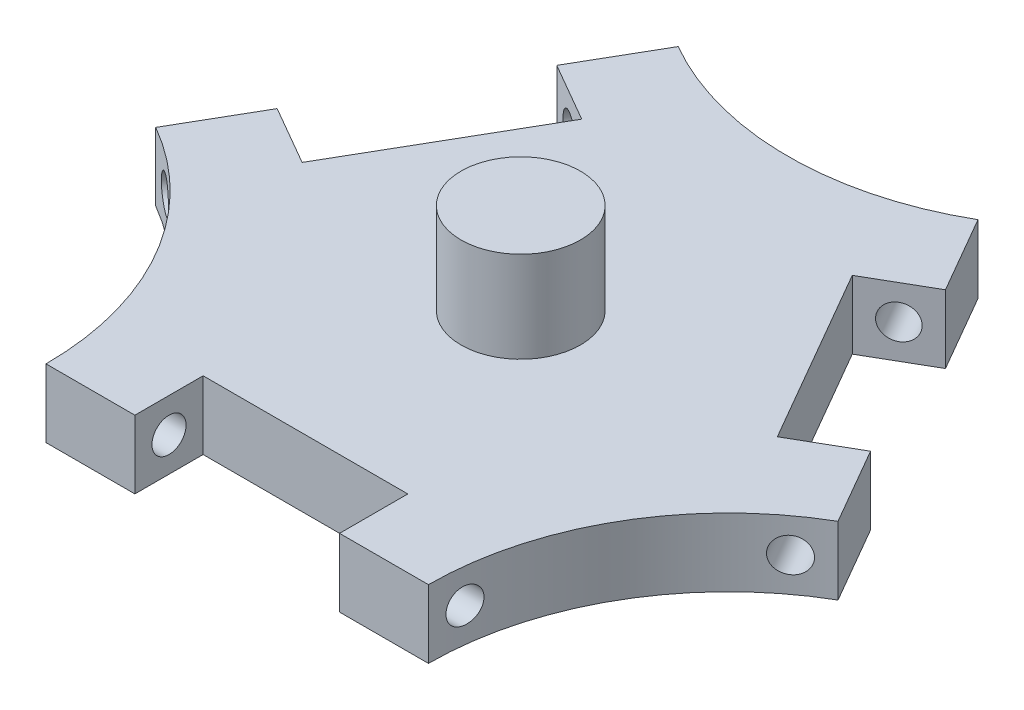
from build123d import *

# Parameters (mm, degrees)
BOSS_EXTRUDE1_DEPTH     = 3
SKETCH2_R               = 2.625
BOSS_EXTRUDE2_DEPTH     = 4
SKETCH3_W               = 9
SKETCH3_H               = 3
CUT_EXTRUDE1_DEPTH      = 46.419722563
CUT_EXTRUDE2_DEPTH      = 47.054735135
CUT_EXTRUDE2_DEPTH_BACK = 47.054735135
SKETCH4_R               = 0.75
CUT_EXTRUDE3_DEPTH      = 33.475581683
CUT_EXTRUDE3_DEPTH_BACK = 33.475581683
SKETCH5_R               = 0.75
CUT_EXTRUDE4_DEPTH      = 34.230257433
CUT_EXTRUDE4_DEPTH_BACK = 34.230257433
SKETCH6_R               = 0.75


with BuildPart() as part:
    # Sketch1 → Boss-Extrude1 (new body)
    with BuildSketch(Plane(origin=(0, 0, 0), x_dir=(1, 0, 0), z_dir=(0, 1, 0))):
        with BuildLine():
            Line((6.591682084, 11.417128277), (15, 25.980762114))
            ThreePointArc((15, 25.980762114), (21.591682084, 24.214526222), (28.183364168, 25.980762114))
            Line((28.183364168, 25.980762114), (36.591682084, 11.417128277))
            ThreePointArc((36.591682084, 11.417128277), (31.766235891, 6.591682084), (30, 0))
            Line((30, 0), (13.183364168, 0))
            ThreePointArc((13.183364168, 0), (11.417128277, 6.591682084), (6.591682084, 11.417128277))
        make_face()
    extrude(amount=BOSS_EXTRUDE1_DEPTH)

    # Sketch2 → Boss-Extrude2 (add)
    with BuildSketch(Plane(origin=(0, 3, 0), x_dir=(1, 0, 0), z_dir=(0, 1, 0))):
        with Locations((21.591682084, 12.465963463)):
            Circle(SKETCH2_R)
    extrude(amount=BOSS_EXTRUDE2_DEPTH)

    # Sketch3 → Cut-Extrude1 (cut, through all)
    with BuildSketch(Plane.XZ):
        with Locations((21.591682084, -1.5)):
            Rectangle(SKETCH3_W, SKETCH3_H)
        Polygon((8.545841042, -14.801830878), (13.045841042, -22.596059512), (15.643917253, -21.096059512), (11.143917253, -13.301830878), align=None)
        Polygon((34.637523126, -14.801830878), (32.039446914, -13.301830878), (27.539446914, -21.096059512), (30.137523126, -22.596059512), align=None)
    extrude(amount=-CUT_EXTRUDE1_DEPTH, mode=Mode.SUBTRACT)

    # Sketch4 → Cut-Extrude2 (cut, two sides: drawn at the far end of the back side and taken through both)
    with BuildSketch(Plane(origin=(2.25, 0, 3.897114317), x_dir=(-0.8660254037844389, 0, 0.4999999999999997), z_dir=(-0.4999999999999997, 0, -0.8660254037844389)).offset(-CUT_EXTRUDE2_DEPTH_BACK)):
        with Locations((-35.89789039, 1.5)):
            Circle(SKETCH4_R)
    extrude(amount=CUT_EXTRUDE2_DEPTH + CUT_EXTRUDE2_DEPTH_BACK, mode=Mode.SUBTRACT)

    # Sketch5 → Cut-Extrude3 (cut, two sides: drawn at the far end of the back side and taken through both)
    with BuildSketch(Plane(origin=(8.545841042, 0, -14.801830878), x_dir=(-0.8660254037844383, 0, -0.5000000000000008), z_dir=(0.5000000000000007, 0, -0.8660254037844382)).offset(-CUT_EXTRUDE3_DEPTH_BACK)):
        with Locations((-1.5, 1.5)):
            Circle(SKETCH5_R)
    extrude(amount=CUT_EXTRUDE3_DEPTH + CUT_EXTRUDE3_DEPTH_BACK, mode=Mode.SUBTRACT)

    # Sketch6 → Cut-Extrude4 (cut, two sides: drawn at the far end of the back side and taken through both)
    with BuildSketch(Plane.ZY.offset(-26.091682084).offset(-CUT_EXTRUDE4_DEPTH_BACK)):
        with Locations((-1.5, 1.5)):
            Circle(SKETCH6_R)
    extrude(amount=CUT_EXTRUDE4_DEPTH + CUT_EXTRUDE4_DEPTH_BACK, mode=Mode.SUBTRACT)


solid = part.part
